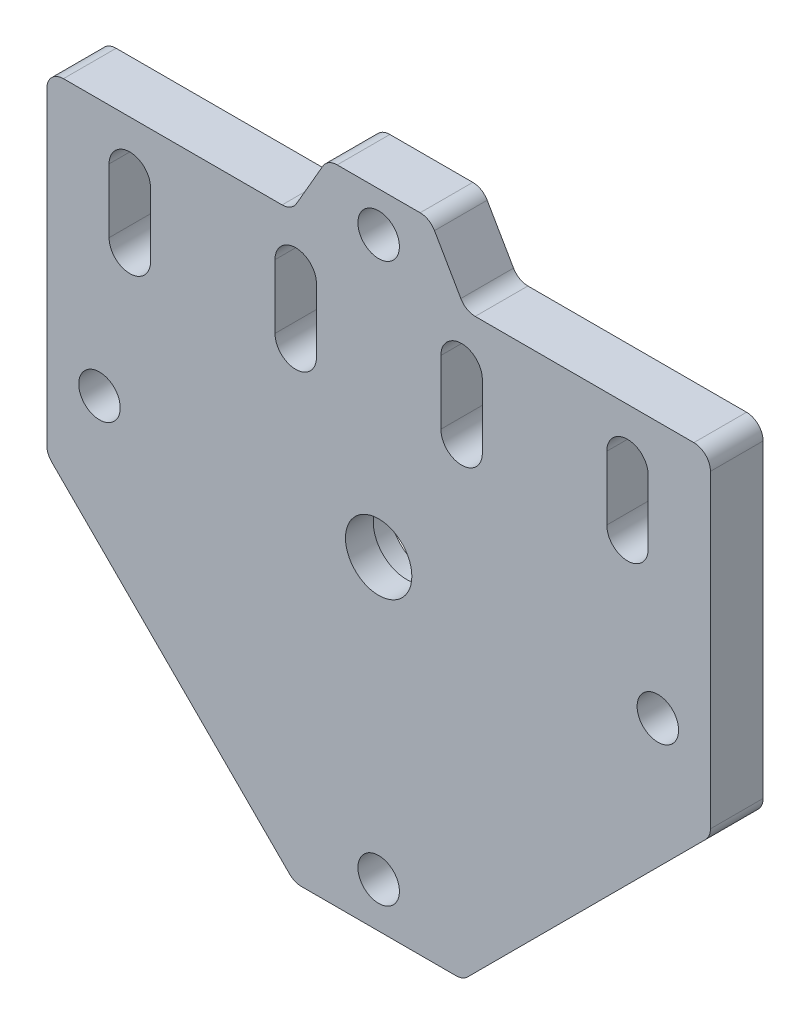
from build123d import *

# Parameters (mm, degrees)
SKETCH1_R                 = 4
SKETCH1_R_2               = 2.5
BOSS_EXTRUDE1_DEPTH       = 6.35
F_5_0MM_DOWEL_SLOT1_DEPTH = 6.35
SKETCH5_R                 = 5.25
CUT_EXTRUDE1_DEPTH        = 3


# Read off the part's stored shape, not the designer's step: Ø5.0mm Dowel Slot1
with BuildPart() as part:
    # Sketch1 → Boss-Extrude1 (new body)
    with BuildSketch(Plane.XY):
        with BuildLine():
            Line((-27.999999098, 10), (-1.639527193, 10))
            ThreePointArc((-1.639527193, 10), (-0.639527193, 10.267949192), (0.092523614, 11))
            Line((0.092523614, 11), (3.267950095, 16.5))
            ThreePointArc((3.267950095, 16.5), (4.000000902, 17.232050808), (5.000000902, 17.5))
            Line((5.000000902, 17.5), (15.000000902, 17.5))
            ThreePointArc((15.000000902, 17.5), (16.000000902, 17.232050808), (16.73205171, 16.5))
            Line((16.73205171, 16.5), (19.907478191, 11))
            ThreePointArc((19.907478191, 11), (20.639528998, 10.267949192), (21.639528998, 10))
            Line((21.639528998, 10), (48.000000902, 10))
            ThreePointArc((48.000000902, 10), (49.414214465, 9.414213562), (50.000000902, 8))
            Line((50.000000902, 8), (50.000000902, -29.321572875))
            ThreePointArc((50.000000902, -29.321572875), (49.847759967, -30.08693974), (49.414214465, -30.735786438))
            Line((49.414214465, -30.735786438), (20.73578734, -59.414213562))
            ThreePointArc((20.73578734, -59.414213562), (20.086940642, -59.847759065), (19.321573778, -60))
            Line((19.321573778, -60), (0.678428027, -60))
            ThreePointArc((0.678428027, -60), (-0.086938838, -59.847759065), (-0.735785535, -59.414213562))
            Line((-0.735785535, -59.414213562), (-29.41421266, -30.735786438))
            ThreePointArc((-29.41421266, -30.735786438), (-29.847758163, -30.08693974), (-29.999999098, -29.321572875))
            Line((-29.999999098, -29.321572875), (-29.999999098, 8))
            ThreePointArc((-29.999999098, 8), (-29.41421266, 9.414213562), (-27.999999098, 10))
        make_face()
        with Locations((10.000000902, -20.95)):
            Circle(SKETCH1_R, mode=Mode.SUBTRACT)
        with Locations((43.658284542, -20.95)):
            Circle(SKETCH1_R_2, mode=Mode.SUBTRACT)
        with Locations((10.000000902, -54.608282784)):
            Circle(SKETCH1_R_2, mode=Mode.SUBTRACT)
        with Locations((-23.658282737, -20.95)):
            Circle(SKETCH1_R_2, mode=Mode.SUBTRACT)
        with Locations(Location((10.000000902, 12.708282784, 0), (0, 0, 180))):
            Circle(SKETCH1_R_2, mode=Mode.SUBTRACT)
    extrude(amount=BOSS_EXTRUDE1_DEPTH)

    # Ø5.0mm Dowel Slot1 outline → Ø5.0mm Dowel Slot1 (cut)
    with BuildSketch(Plane.XY):
        with BuildLine():
            Line((22.5, -3.85), (22.5, 3.85))
            ThreePointArc((22.5, 3.85), (20, 6.35), (17.5, 3.85))
            Line((17.5, 3.85), (17.5, -3.85))
            ThreePointArc((17.5, -3.85), (20, -6.35), (22.5, -3.85))
        make_face()
        with BuildLine():
            Line((-17.5, -3.85), (-17.5, 3.85))
            ThreePointArc((-17.5, 3.85), (-20, 6.35), (-22.5, 3.85))
            Line((-22.5, 3.85), (-22.5, -3.85))
            ThreePointArc((-22.5, -3.85), (-20, -6.35), (-17.5, -3.85))
        make_face()
        with BuildLine():
            Line((2.5, -3.85), (2.5, 3.85))
            ThreePointArc((2.5, 3.85), (0, 6.35), (-2.5, 3.85))
            Line((-2.5, 3.85), (-2.5, -3.85))
            ThreePointArc((-2.5, -3.85), (0, -6.35), (2.5, -3.85))
        make_face()
        with BuildLine():
            Line((42.5, -3.85), (42.5, 3.85))
            ThreePointArc((42.5, 3.85), (40, 6.35), (37.5, 3.85))
            Line((37.5, 3.85), (37.5, -3.85))
            ThreePointArc((37.5, -3.85), (40, -6.35), (42.5, -3.85))
        make_face()
    extrude(amount=F_5_0MM_DOWEL_SLOT1_DEPTH, mode=Mode.SUBTRACT)

    # Sketch5 → Cut-Extrude1 (cut)
    with BuildSketch(Plane(origin=(0, 0, 0), x_dir=(-1, 0, 0), z_dir=(0, 0, -1))):
        with Locations((-10.000000902, -20.95)):
            Circle(SKETCH5_R)
    extrude(amount=-CUT_EXTRUDE1_DEPTH, mode=Mode.SUBTRACT)


solid = part.part
